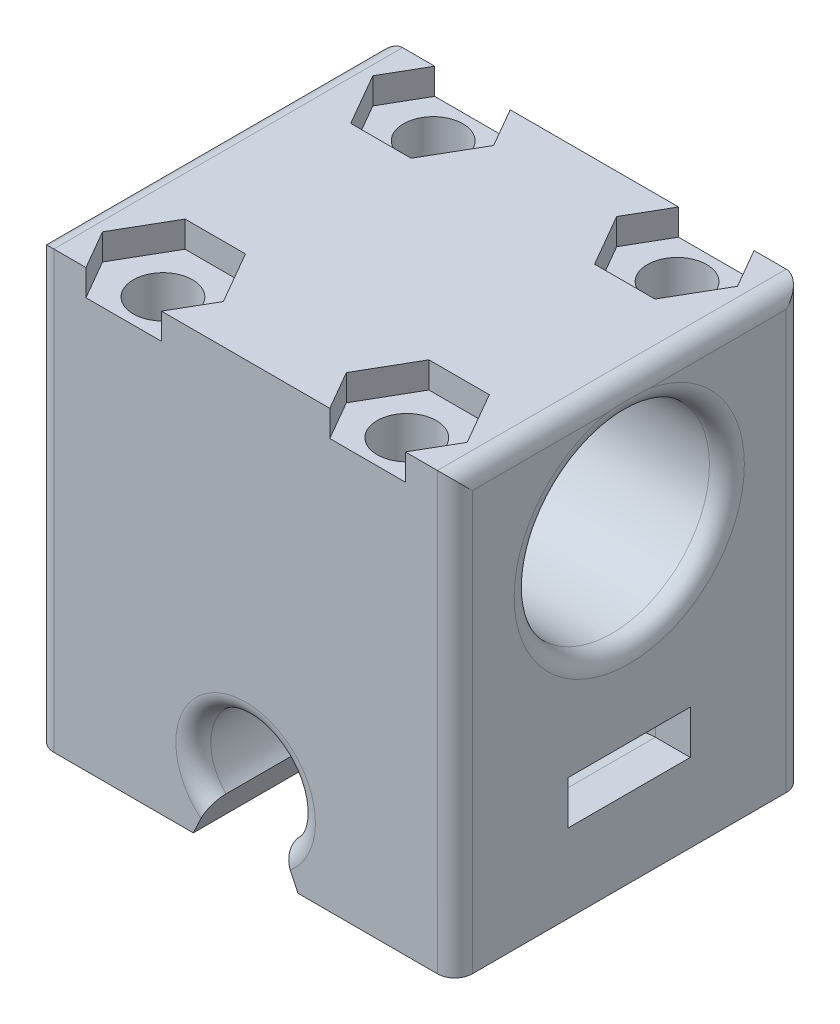
from build123d import *

# Parameters (mm, degrees)
CROQUIS1_W              = 23.999999999999773
CROQUIS1_H              = 19.99999938803319
SALIENTE_EXTRUIR1_DEPTH = 25
CORTAR_EXTRUIR1_DEPTH   = 60.75663166018996
CROQUIS3_R              = 5.599999999999993
CORTAR_EXTRUIR2_DEPTH   = 43.33702219441687
CROQUIS4_R              = 1.6999999999999995
CORTAR_EXTRUIR3_DEPTH   = 62.33741517329244
CROQUIS8_W              = 7.000000000000005
CROQUIS8_H              = 2.499999999999975
CORTAR_EXTRUIR7_DEPTH   = 1.5
REDONDEO1_R             = 1


with BuildPart() as part:
    # Croquis1 → Saliente-Extruir1 (new body)
    with BuildSketch(Plane.XZ):
        with Locations((38.456466898211374, 14.319199476403412)):
            Rectangle(CROQUIS1_W, CROQUIS1_H)
    extrude(amount=-SALIENTE_EXTRUIR1_DEPTH)

    # Croquis2 → Cortar-Extruir1 (cut, through all)
    with BuildSketch(Plane.XY.offset(24.319199170420006)):
        with BuildLine():
            Line((35.456466898211275, 0), (36.335146554651615, 1.8786796564403407))
            ThreePointArc((36.335146554651615, 1.8786796564403407), (38.45646689821126, 7.00000000000005), (40.57778724177091, 1.8786796564403407))
            Line((40.57778724177091, 1.8786796564403407), (41.45646689821126, 0))
            Line((41.45646689821126, 0), (35.456466898211275, 0))
        make_face()
    extrude(amount=-CORTAR_EXTRUIR1_DEPTH, mode=Mode.SUBTRACT)

    # Croquis3 → Cortar-Extruir2 (cut, through all)
    with BuildSketch(Plane(origin=(50.45646689821126, 0, 0), x_dir=(0, 0, -1), z_dir=(1, 0, 0))):
        with Locations((-14.319199170420013, 17.499998559923498)):
            Circle(CROQUIS3_R)
    extrude(amount=-CORTAR_EXTRUIR2_DEPTH, mode=Mode.SUBTRACT)

    # Croquis4 → Cortar-Extruir3 (cut, through all)
    with BuildSketch(Plane.XZ):
        with Locations(Location((31.464341614174252, 22.06919978238682, 0), (0, 0, 270))):
            Circle(CROQUIS4_R)
        with Locations(Location((45.448592182248724, 22.06919978238682, 0), (0, 0, 90))):
            Circle(CROQUIS4_R)
        with Locations(Location((45.448592182248724, 6.5691985584531984, 0), (0, 0, 270))):
            Circle(CROQUIS4_R)
        with Locations(Location((31.464341614174252, 6.569198558453197, 0), (0, 0, 90))):
            Circle(CROQUIS4_R)
    extrude(amount=-CORTAR_EXTRUIR3_DEPTH, mode=Mode.SUBTRACT)

    # Cortar-Barrer2: sweep along a path in Croquis9
    with BuildLine(Plane(origin=(0, 0, 10.819199782386816), x_dir=(-1, 0, 0), z_dir=(0, 0, -1))) as cortar_barrer2_path:
        Line((-50.45646689821126, 6.999998762857437), (-48.45646689821129, 6.999998762857437))
        ThreePointArc((-48.45646689821129, 6.999998762857437), (-44.92093299227851, 5.5355326687901805), (-43.45646689821125, 1.9999987628574059))
        Line((-43.45646689821125, 1.9999987628574059), (-43.45646689821125, -1.23714255593e-06))
    # Croquis8 → Cortar-Barrer2 (sweep, cut)
    with BuildSketch(Plane(origin=(50.45646689821126, 0, 0), x_dir=(0, 0, -1), z_dir=(1, 0, 0))):
        with Locations((-14.319199782386818, 5.749998762857451)):
            Rectangle(CROQUIS8_W, CROQUIS8_H)
    cortar_barrer2 = sweep(path=cortar_barrer2_path.line, mode=Mode.SUBTRACT)

    # Simetría1: Cortar-Barrer2 across plane
    add(cortar_barrer2.mirror(Plane(origin=(38.45646689821126, 0, 0), x_dir=(0, 0, 1), z_dir=(1, 0, 0))), mode=Mode.SUBTRACT)

    # Croquis11 → Cortar-Extruir7 (cut)
    with BuildSketch(Plane(origin=(0, 25, 0), x_dir=(1, 0, 0), z_dir=(0, 1, 0))):
        Polygon((47.180642989817585, -19.069199782386846), (43.716541374679856, -19.069199782386846), (41.98449056711099, -22.06919978238682), (43.716541374679856, -25.0691997823868), (47.180642989817585, -25.0691997823868), (48.91269379738645, -22.06919978238682), align=None)
        Polygon((34.928443229312, -22.06919978238682), (33.196392421743134, -19.069199782386825), (29.732290806605373, -19.069199782386825), (28.000239999036502, -22.06919978238682), (29.73229080660538, -25.069199782386818), (33.19639242174313, -25.069199782386814), align=None)
        Polygon((34.928443229312016, -6.569198558453194), (33.196392421743134, -3.569198558453189), (29.732290806605366, -3.56919855845319), (28.000239999036484, -6.569198558453203), (29.732290806605363, -9.569198558453209), (33.196392421743134, -9.569198558453209), align=None)
        Polygon((47.18064298981763, -9.569198558453236), (48.91269379738652, -6.569198558453209), (47.18064298981762, -3.5691985584531754), (43.716541374679835, -3.5691985584531754), (41.98449056711095, -6.569198558453195), (43.71654137467985, -9.569198558453236), align=None)
    extrude(amount=-CORTAR_EXTRUIR7_DEPTH, mode=Mode.SUBTRACT)

    # Redondeo1
    # the kernel refuses this fillet: 1 mm, written as the material it takes off along each edge
    with BuildSketch(Plane(origin=(50.45646689821126, 25, 26.819199170420006), x_dir=(0, -1, 0), z_dir=(0, 0, -1))) as redondeo1_piece_1:
        with BuildLine():
            CenterArc((REDONDEO1_R, REDONDEO1_R), REDONDEO1_R, 180, 90)
            Line((0, REDONDEO1_R), (0, 0))
            Line((0, 0), (REDONDEO1_R, 0))
        make_face()
    extrude(amount=24.99999938803319, mode=Mode.SUBTRACT)
    with BuildSketch(Plane(origin=(38.45646689821127, 4.000000000000019, 4.319199782386818), x_dir=(0.003141587485877974, -0.9999950652018582, 0), z_dir=(-0.9999950652018582, -0.003141587485877974, 0))) as redondeo1_piece_2:
        with BuildLine():
            CenterArc((3.0000000000000306 + REDONDEO1_R, REDONDEO1_R), REDONDEO1_R, 180, 90)
            Line((3.0000000000000306 + REDONDEO1_R, 0), (3.0000000000000306, 0))
            Line((3.0000000000000306, 0), (3.0000000000000306, REDONDEO1_R))
        make_face()
    revolve(axis=Axis((38.45646689821127, 4.000000000000019, 4.319199782386818), (0, 0, 1)), revolution_arc=359.64, mode=Mode.SUBTRACT)
    with BuildSketch(Plane(origin=(38.45646689821127, 4.000000000000019, 24.319199170420006), x_dir=(-0.0031415874858803424, -0.9999950652018582, 0), z_dir=(0.9999950652018582, -0.0031415874858803424, 0))) as redondeo1_piece_3:
        with BuildLine():
            CenterArc((3.0000000000000298 + REDONDEO1_R, REDONDEO1_R), REDONDEO1_R, 180, 90)
            Line((3.0000000000000298, REDONDEO1_R), (3.0000000000000298, 0))
            Line((3.0000000000000298, 0), (3.0000000000000298 + REDONDEO1_R, 0))
        make_face()
    revolve(axis=Axis((38.45646689821127, 4.000000000000019, 24.319199170420006), (0, 0, -1)), revolution_arc=359.64000000000004, mode=Mode.SUBTRACT)
    with BuildSketch(Plane(origin=(26.456466898211488, 17.499998559923498, 14.319199170420013), x_dir=(0, 0, -1), z_dir=(0, -1, 0))) as redondeo1_piece_4:
        with BuildLine():
            CenterArc((5.599999999999994 + REDONDEO1_R, REDONDEO1_R), REDONDEO1_R, 180, 90)
            Line((5.599999999999994, REDONDEO1_R), (5.599999999999994, 0))
            Line((5.599999999999994, 0), (5.599999999999994 + REDONDEO1_R, 0))
        make_face()
    revolve(axis=Axis((26.456466898211488, 17.499998559923498, 14.319199170420013), (1, 0, 0)), mode=Mode.SUBTRACT)
    with BuildSketch(Plane(origin=(50.45646689821126, 17.499998559923498, 14.319199170420013), x_dir=(0, 0, -1), z_dir=(0, -1, 0))) as redondeo1_piece_5:
        with BuildLine():
            CenterArc((5.599999999999994 + REDONDEO1_R, -REDONDEO1_R), REDONDEO1_R, 90, 90)
            Line((5.599999999999994, -REDONDEO1_R), (5.599999999999994, 0))
            Line((5.599999999999994, 0), (5.599999999999994 + REDONDEO1_R, 0))
        make_face()
    revolve(axis=Axis((50.45646689821126, 17.499998559923498, 14.319199170420013), (1, 0, 0)), mode=Mode.SUBTRACT)
    with BuildSketch(Plane(origin=(26.456466898211488, 25, 1.8191997823868178), x_dir=(1, 0, 0), z_dir=(0, 0, 1))) as redondeo1_piece_6:
        with BuildLine():
            CenterArc((REDONDEO1_R, -REDONDEO1_R), REDONDEO1_R, 90, 90)
            Line((0, -REDONDEO1_R), (0, 0))
            Line((0, 0), (REDONDEO1_R, 0))
        make_face()
    extrude(amount=24.99999938803319, mode=Mode.SUBTRACT)
    with BuildSketch(Plane(origin=(26.456466898211488, -2.5, 24.319199170420006), x_dir=(1, 0, 0), z_dir=(0, 1, 0))) as redondeo1_piece_7:
        with BuildLine():
            CenterArc((REDONDEO1_R, REDONDEO1_R), REDONDEO1_R, 180, 90)
            Line((0, REDONDEO1_R), (0, 0))
            Line((0, 0), (REDONDEO1_R, 0))
        make_face()
    extrude(amount=30.000000000000004, mode=Mode.SUBTRACT)
    with BuildSketch(Plane(origin=(50.45646689821126, -2.5, 24.319199170420006), x_dir=(-1, 0, 0), z_dir=(0, 1, 0))) as redondeo1_piece_8:
        with BuildLine():
            CenterArc((REDONDEO1_R, -REDONDEO1_R), REDONDEO1_R, 90, 90)
            Line((0, -REDONDEO1_R), (0, 0))
            Line((0, 0), (REDONDEO1_R, 0))
        make_face()
    extrude(amount=30.000000000000004, mode=Mode.SUBTRACT)
    with BuildSketch(Plane(origin=(50.45646689821126, -2.5, 4.319199782386818), x_dir=(0, 0, 1), z_dir=(0, 1, 0))) as redondeo1_piece_9:
        with BuildLine():
            CenterArc((REDONDEO1_R, -REDONDEO1_R), REDONDEO1_R, 90, 90)
            Line((0, -REDONDEO1_R), (0, 0))
            Line((0, 0), (REDONDEO1_R, 0))
        make_face()
    extrude(amount=30.000000000000004, mode=Mode.SUBTRACT)
    with BuildSketch(Plane(origin=(26.456466898211488, -2.5, 4.319199782386818), x_dir=(0, 0, 1), z_dir=(0, 1, 0))) as redondeo1_piece_10:
        with BuildLine():
            CenterArc((REDONDEO1_R, REDONDEO1_R), REDONDEO1_R, 180, 90)
            Line((0, REDONDEO1_R), (0, 0))
            Line((0, 0), (REDONDEO1_R, 0))
        make_face()
    extrude(amount=30.000000000000004, mode=Mode.SUBTRACT)


solid = part.part
